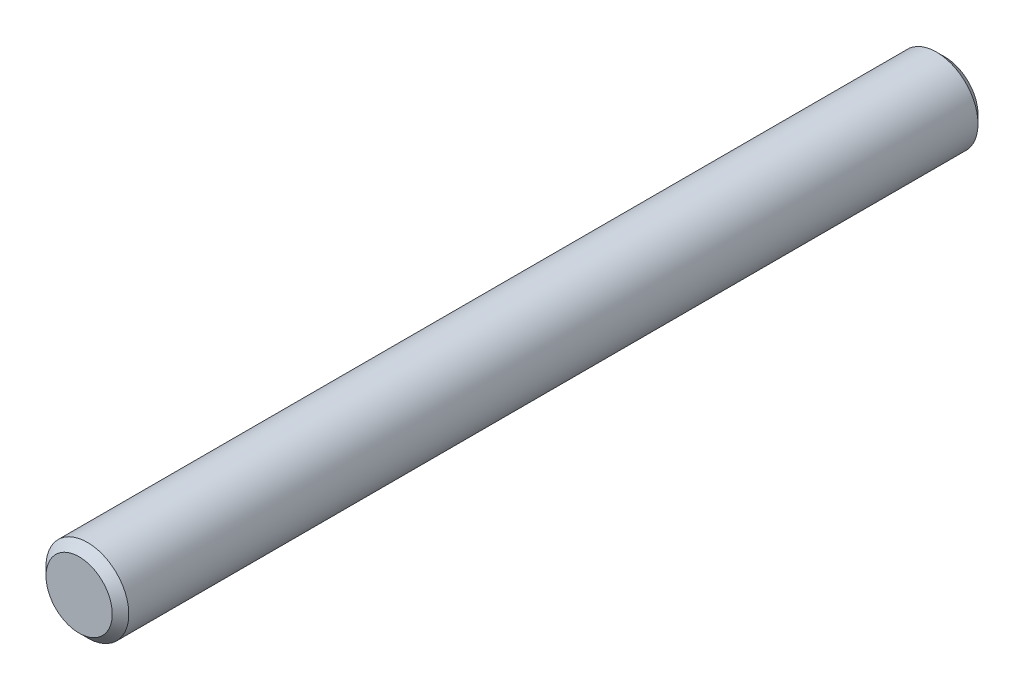
from build123d import *

# Parameters (mm, degrees)
SKETCH1_R      = 4.7625
EXTRUDE1_DEPTH = 49.784
CHAMFER1_SIZE  = 0.9525


with BuildPart() as part:
    # Sketch1 → Extrude1 (new, symmetric)
    with BuildSketch(Plane.XY):
        Circle(SKETCH1_R)
    extrude(amount=EXTRUDE1_DEPTH, both=True)

    # Chamfer1
    chamfer1_edges = [part.edges().sort_by_distance(p)[0] for p in [
        (-4.7625, 0, -49.784),
        (-4.7625, 0, 49.784),
    ]]
    chamfer(chamfer1_edges, length=CHAMFER1_SIZE)


solid = part.part
